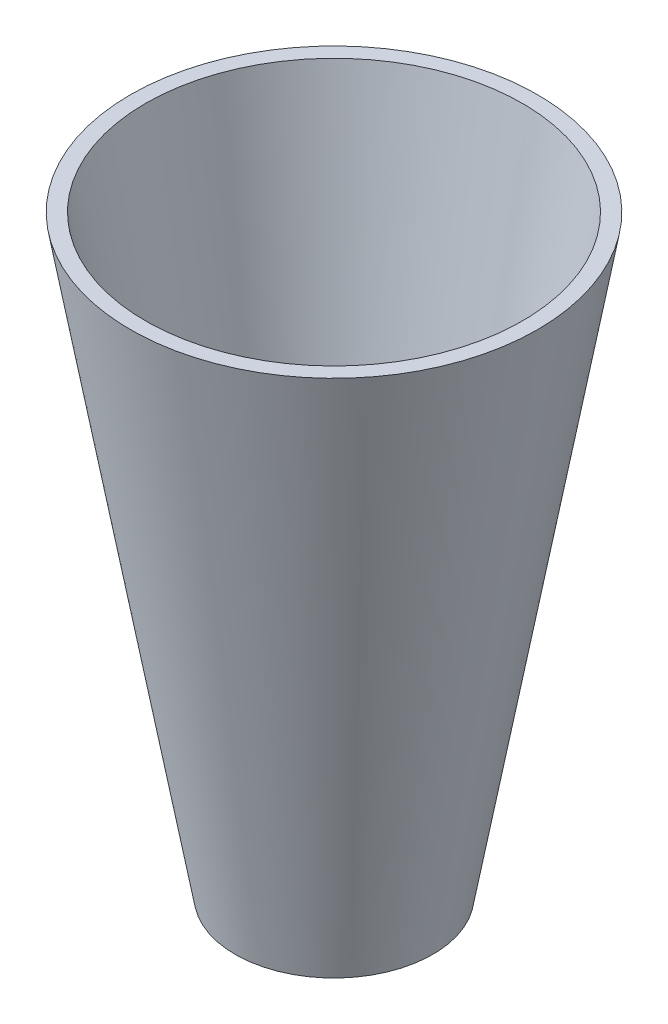
from build123d import *


with BuildPart() as part:
    # Sketch1 → Revolve1 (revolve)
    with BuildSketch(Plane.XY):
        Polygon((0, 0), (10, 0), (20.579618843, 60), (19.056478925, 60), (8.741350553, 1.5), (0, 1.5), align=None)
    revolve(axis=Axis((0, 1.5, 0), (0, -1, 0)))


solid = part.part
